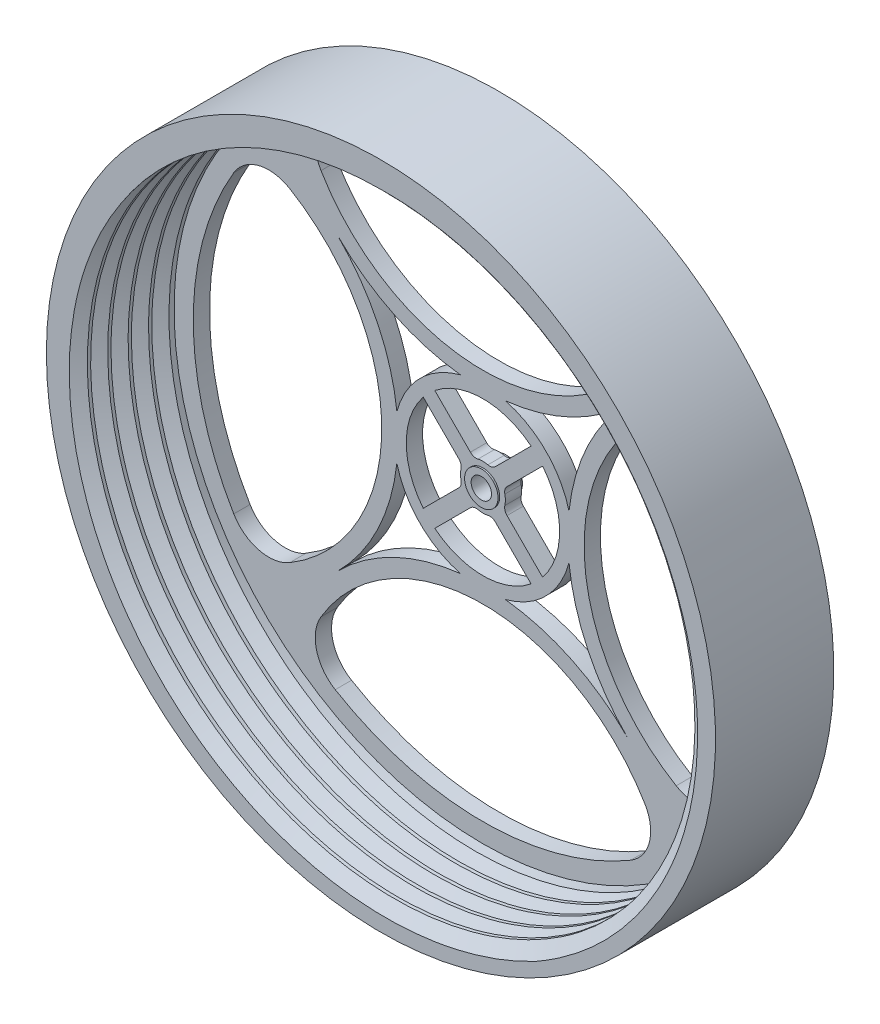
from build123d import *

# Parameters (mm, degrees)
SKETCH22_R               = 41
SKETCH22_R_2             = 37.85
BOSS_EXTRUDE6_DEPTH      = 12.5
SKETCH23_R               = 41
SKETCH23_R_2             = 1.25
BOSS_EXTRUDE7_DEPTH      = 2
BOSS_EXTRUDE8_DEPTH      = 0.2
BOSS_EXTRUDE8_DEPTH_BACK = 2.8
SKETCH24_R               = 2.05
SKETCH24_R_2             = 1.25
CUT_SWEEP1_PITCH         = 2.5


with BuildPart() as part:
    # Sketch22 → Boss-Extrude6 (new body)
    with BuildSketch(Plane(origin=(0, 0, 0), x_dir=(-1, 0, 0), z_dir=(0, 0, -1))):
        Circle(SKETCH22_R)
        Circle(SKETCH22_R_2, mode=Mode.SUBTRACT)
    extrude(amount=BOSS_EXTRUDE6_DEPTH)

    # Sketch23 → Boss-Extrude7 (add)
    with BuildSketch(Plane(origin=(0, 0, -12.5), x_dir=(-1, 0, 0), z_dir=(0, 0, -1))):
        Circle(SKETCH23_R)
        with BuildLine():
            ThreePointArc((-2.739813334, -10.547677004), (-10.859395782, -12.868196642), (-17.75, -17.75))
            ThreePointArc((-17.75, -17.75), (-12.868196642, -10.859395782), (-10.547677004, -2.739813334))
            ThreePointArc((-10.547677004, -2.739813334), (-7.705844123, -7.705844123), (-2.739813334, -10.547677004))
        make_face(mode=Mode.SUBTRACT)
        with BuildLine():
            ThreePointArc((18.102251223, -30.537820824), (0, -35.5), (-18.102251223, -30.537820824))
            ThreePointArc((-18.102251223, -30.537820824), (-20.398116099, -27.4701477), (-19.848403647, -23.678125794))
            ThreePointArc((-19.848403647, -23.678125794), (0, -12.397709268), (19.848403647, -23.678125794))
            ThreePointArc((19.848403647, -23.678125794), (20.398116099, -27.4701477), (18.102251223, -30.537820824))
        make_face(mode=Mode.SUBTRACT)
        with BuildLine():
            ThreePointArc((5.900348837, -7.314562399), (0, -9.397709268), (-5.900348837, -7.314562399))
            Line((-5.900348837, -7.314562399), (-1.535938024, -2.950151587))
            ThreePointArc((-1.535938024, -2.950151587), (-1.106405405, -2.696554155), (-0.607809578, -2.68198947))
            ThreePointArc((-0.607809578, -2.68198947), (0, -2.75), (0.607809578, -2.68198947))
            ThreePointArc((0.607809578, -2.68198947), (1.106405405, -2.696554155), (1.535938024, -2.950151587))
            Line((1.535938024, -2.950151587), (5.900348837, -7.314562399))
        make_face(mode=Mode.SUBTRACT)
        with BuildLine():
            ThreePointArc((17.75, -17.75), (10.859395782, -12.868196642), (2.739813334, -10.547677004))
            ThreePointArc((2.739813334, -10.547677004), (7.705844123, -7.705844123), (10.547677004, -2.739813334))
            ThreePointArc((10.547677004, -2.739813334), (12.868196642, -10.859395782), (17.75, -17.75))
        make_face(mode=Mode.SUBTRACT)
        with BuildLine():
            ThreePointArc((-30.537820824, -18.102251223), (-35.5, 0), (-30.537820824, 18.102251223))
            ThreePointArc((-30.537820824, 18.102251223), (-27.4701477, 20.398116099), (-23.678125794, 19.848403647))
            ThreePointArc((-23.678125794, 19.848403647), (-12.397709268, 0), (-23.678125794, -19.848403647))
            ThreePointArc((-23.678125794, -19.848403647), (-27.4701477, -20.398116099), (-30.537820824, -18.102251223))
        make_face(mode=Mode.SUBTRACT)
        with BuildLine():
            ThreePointArc((-7.314562399, -5.900348837), (-9.397709268, 0), (-7.314562399, 5.900348837))
            Line((-7.314562399, 5.900348837), (-2.950151587, 1.535938024))
            ThreePointArc((-2.950151587, 1.535938024), (-2.696554155, 1.106405405), (-2.68198947, 0.607809578))
            ThreePointArc((-2.68198947, 0.607809578), (-2.75, 0), (-2.68198947, -0.607809578))
            ThreePointArc((-2.68198947, -0.607809578), (-2.696554155, -1.106405405), (-2.950151587, -1.535938024))
            Line((-2.950151587, -1.535938024), (-7.314562399, -5.900348837))
        make_face(mode=Mode.SUBTRACT)
        with BuildLine():
            ThreePointArc((-10.547677004, 2.739813334), (-12.868196642, 10.859395782), (-17.75, 17.75))
            ThreePointArc((-17.75, 17.75), (-10.859395782, 12.868196642), (-2.739813334, 10.547677004))
            ThreePointArc((-2.739813334, 10.547677004), (-7.705844123, 7.705844123), (-10.547677004, 2.739813334))
        make_face(mode=Mode.SUBTRACT)
        Circle(SKETCH23_R_2, mode=Mode.SUBTRACT)
        with BuildLine():
            ThreePointArc((2.68198947, 0.607809578), (2.696554155, 1.106405405), (2.950151587, 1.535938024))
            Line((2.950151587, 1.535938024), (7.314562399, 5.900348837))
            ThreePointArc((7.314562399, 5.900348837), (9.397709268, 0), (7.314562399, -5.900348837))
            Line((7.314562399, -5.900348837), (2.950151587, -1.535938024))
            ThreePointArc((2.950151587, -1.535938024), (2.696554155, -1.106405405), (2.68198947, -0.607809578))
            ThreePointArc((2.68198947, -0.607809578), (2.75, 0), (2.68198947, 0.607809578))
        make_face(mode=Mode.SUBTRACT)
        with BuildLine():
            Line((-1.535938024, 2.950151587), (-5.900348837, 7.314562399))
            ThreePointArc((-5.900348837, 7.314562399), (0, 9.397709268), (5.900348837, 7.314562399))
            Line((5.900348837, 7.314562399), (1.535938024, 2.950151587))
            ThreePointArc((1.535938024, 2.950151587), (1.106405405, 2.696554155), (0.607809578, 2.68198947))
            ThreePointArc((0.607809578, 2.68198947), (0, 2.75), (-0.607809578, 2.68198947))
            ThreePointArc((-0.607809578, 2.68198947), (-1.106405405, 2.696554155), (-1.535938024, 2.950151587))
        make_face(mode=Mode.SUBTRACT)
        with BuildLine():
            ThreePointArc((2.739813334, 10.547677004), (10.859395782, 12.868196642), (17.75, 17.75))
            ThreePointArc((17.75, 17.75), (12.868196642, 10.859395782), (10.547677004, 2.739813334))
            ThreePointArc((10.547677004, 2.739813334), (7.705844123, 7.705844123), (2.739813334, 10.547677004))
        make_face(mode=Mode.SUBTRACT)
        with BuildLine():
            ThreePointArc((30.537820824, 18.102251223), (35.5, 0), (30.537820824, -18.102251223))
            ThreePointArc((30.537820824, -18.102251223), (27.4701477, -20.398116099), (23.678125794, -19.848403647))
            ThreePointArc((23.678125794, -19.848403647), (12.397709268, 0), (23.678125794, 19.848403647))
            ThreePointArc((23.678125794, 19.848403647), (27.4701477, 20.398116099), (30.537820824, 18.102251223))
        make_face(mode=Mode.SUBTRACT)
        with BuildLine():
            ThreePointArc((-18.102251223, 30.537820824), (0, 35.5), (18.102251223, 30.537820824))
            ThreePointArc((18.102251223, 30.537820824), (20.398116099, 27.4701477), (19.848403647, 23.678125794))
            ThreePointArc((19.848403647, 23.678125794), (0, 12.397709268), (-19.848403647, 23.678125794))
            ThreePointArc((-19.848403647, 23.678125794), (-20.398116099, 27.4701477), (-18.102251223, 30.537820824))
        make_face(mode=Mode.SUBTRACT)
    extrude(amount=BOSS_EXTRUDE7_DEPTH)

    # Sketch24 → Boss-Extrude8 (add, two sides: drawn at the far end of the back side and taken through both)
    with BuildSketch(Plane.XY.offset(-12.5).offset(-BOSS_EXTRUDE8_DEPTH_BACK)):
        Circle(SKETCH24_R)
        Circle(SKETCH24_R_2, mode=Mode.SUBTRACT)
    extrude(amount=BOSS_EXTRUDE8_DEPTH + BOSS_EXTRUDE8_DEPTH_BACK)

    # Cut-Sweep1: the profile of Sketch27 screwed along a right-hand helix of 5 turns, 10 arcs to a turn; built about Z, then put on its axis
    cut_sweep1_z = Axis((0, 0, 0), (0, 0, 1))
    cut_sweep1_corners = [(39.45, 0, -1.05), (37.85, 0, -2.1), (36.85, 0, -2.1), (36.85, 0, 0), (37.85, 0, 0)]
    with BuildLine(mode=Mode.PRIVATE) as cut_sweep1_profile:
        Line(cut_sweep1_corners[0], cut_sweep1_corners[1])
        Line(cut_sweep1_corners[1], cut_sweep1_corners[2])
        Line(cut_sweep1_corners[2], cut_sweep1_corners[3])
        Line(cut_sweep1_corners[3], cut_sweep1_corners[4])
        Line(cut_sweep1_corners[4], cut_sweep1_corners[0])
    cut_sweep1_cap = Face(cut_sweep1_profile.wire())
    cut_sweep1_turn_angles = [0, 18, 36, 54, 72, 90, 108, 126, 144, 162, 180, 198, 216, 234, 252, 270, 288, 306, 324, 342, 360]
    cut_sweep1_turn_weights = [1, 0.9510565162951535, 1, 0.9510565162951535, 1, 0.9510565162951535, 1, 0.9510565162951535, 1, 0.9510565162951535, 1, 0.9510565162951535, 1, 0.9510565162951535, 1, 0.9510565162951535, 1, 0.9510565162951535, 1, 0.9510565162951535, 1]
    cut_sweep1_turn_rails = [Edge.make_bspline([Vector(p[0], p[1], 0).rotate(cut_sweep1_z, cut_sweep1_turn_angles[k]) / cut_sweep1_turn_weights[k] + Vector(0, 0, p[2] + CUT_SWEEP1_PITCH * cut_sweep1_turn_angles[k] / 360) for k in range(21)], [0, 0, 0, 1, 1, 2, 2, 3, 3, 4, 4, 5, 5, 6, 6, 7, 7, 8, 8, 9, 9, 10, 10, 10], 2, cut_sweep1_turn_weights) for p in cut_sweep1_corners]
    cut_sweep1_turn_sides = [Face.make_surface_from_curves(cut_sweep1_turn_rails[p[0]], cut_sweep1_turn_rails[p[1]]) for p in [(0, 1), (1, 2), (2, 3), (3, 4), (4, 0)]]
    cut_sweep1 = Plane(origin=(0, 0, 0), x_dir=(0, 1, 0), z_dir=(0, 0, -1)) * Solid(Shell([*[p.moved(Location((0, 0, CUT_SWEEP1_PITCH * i))) for i in range(5) for p in cut_sweep1_turn_sides], cut_sweep1_cap, cut_sweep1_cap.rotate(cut_sweep1_z, 1800).moved(Location((0, 0, CUT_SWEEP1_PITCH * 1800 / 360)))]))
    add(cut_sweep1, mode=Mode.SUBTRACT)


solid = part.part
